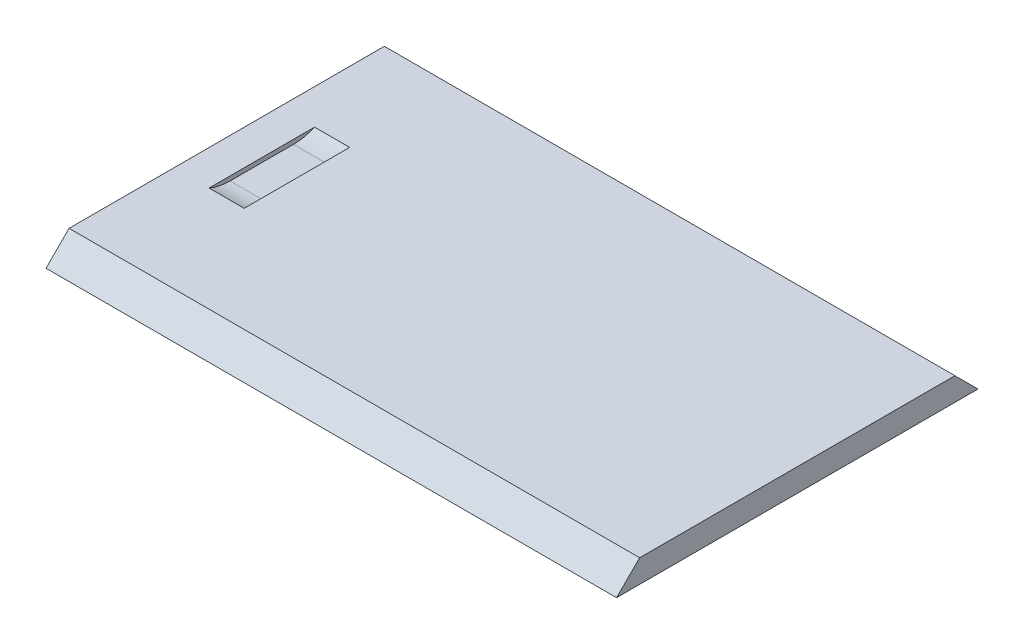
from build123d import *

# Parameters (mm, degrees)
NRG_PSU_CASE_1_START = -230.550293706
NRG_PSU_CASE_1_DEPTH = 165.1
SKETCH2_W            = 10.16
SKETCH2_H            = 30.52357951
CUT_EXTRUDE1_DEPTH   = 1.27
FILLET1_R            = 15.24


# Read off the part's stored shape, not the designer's step: -NRG_PSU_CASE-1
with BuildPart() as part:
    # -NRG_PSU_CASE-1 outline → -NRG_PSU_CASE-1 (new body)
    with BuildSketch(Plane.YZ.offset(NRG_PSU_CASE_1_START)):
        Polygon((42.926, 50.844880664), (36.249795103, 57.521085561), (36.249795103, -47.060903743), (42.926, -40.384698846), align=None)
    extrude(amount=NRG_PSU_CASE_1_DEPTH)

    # Sketch2 → Cut-Extrude1 (cut)
    with BuildSketch(Plane(origin=(0, 42.926, 0), x_dir=(1, 0, 0), z_dir=(0, 1, 0))):
        with Locations((-215.310293706, -5.230090909)):
            Rectangle(SKETCH2_W, SKETCH2_H)
    extrude(amount=-CUT_EXTRUDE1_DEPTH, mode=Mode.SUBTRACT)

    # Fillet1
    # the kernel refuses this fillet: 15.24 mm, written as the material it adds along each edge
    with BuildSketch(Plane(origin=(-195.00352862, 41.656, 20.491880664), x_dir=(0, 1, 0), z_dir=(-1, 0, 0)), Plane(origin=(-220.390293706, 41.656, -10.031698846), x_dir=(0, 1, 0), z_dir=(1, 0, 0))) as fillet1_piece_1:
        with BuildLine():
            CenterArc((15.24, 6.090706035), FILLET1_R, 180, 23.556464309)
            Line((0, 6.090706035), (0, 0))
            Line((0, 0), (1.27, 0))
        make_face()
    extrude(amount=25.386765087)


solid = part.part
